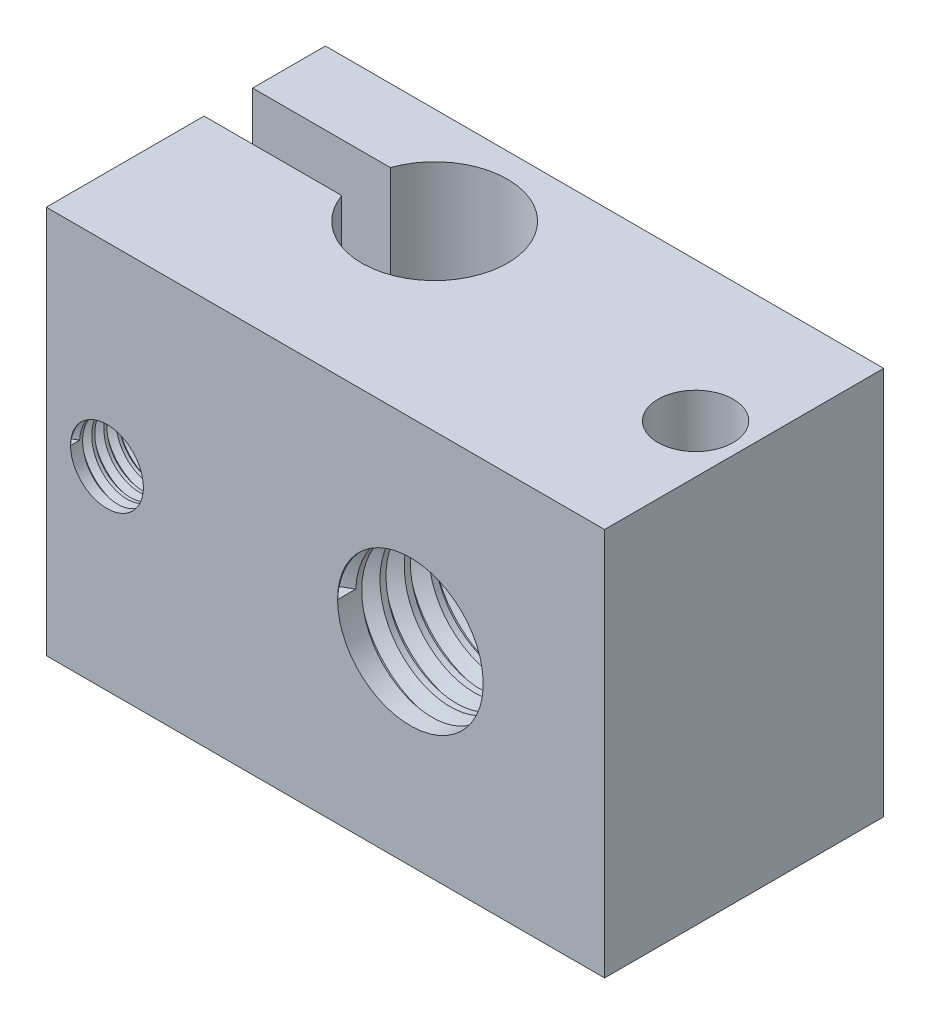
from build123d import *
from build123d.topology import SkipClean

# Parameters (mm, degrees)
SKETCH1_W           = 23
SKETCH1_H           = 16
SKETCH1_R           = 3
SKETCH1_R_2         = 1.5
BOSS_EXTRUDE1_DEPTH = 11.5
SKETCH10_R          = 1.55
CUT_EXTRUDE1_DEPTH  = 26.382080293
SKETCH11_R          = 1.5
CUT_EXTRUDE2_DEPTH  = 6.025
THREAD1_PITCH       = 0.5
THREAD2_PITCH       = 1
THREAD3_PITCH       = 0.5


with BuildPart() as part:
    # Sketch1 → Boss-Extrude1 (new body)
    with BuildSketch(Plane.XY):
        with Locations((4.5, -0.903225806)):
            Rectangle(SKETCH1_W, SKETCH1_H)
        with Locations((8, -0.903225806)):
            Circle(SKETCH1_R, mode=Mode.SUBTRACT)
        with Locations((-4.5, -0.903225806)):
            Circle(SKETCH1_R_2, mode=Mode.SUBTRACT)
    extrude(amount=BOSS_EXTRUDE1_DEPTH)

    # Sketch10 → Cut-Extrude1 (cut, through all)
    with BuildSketch(Plane.XZ.offset(8.903225806)):
        with Locations(Location((14, 5.75, 0), (0, 0, 270))):
            Circle(SKETCH10_R)
        with BuildLine():
            Line((-1.328427125, 5), (-7, 5))
            Line((-7, 5), (-7, 3))
            Line((-7, 3), (-1.328427125, 3))
            ThreePointArc((-1.328427125, 3), (4.5, 4), (-1.328427125, 5))
        make_face()
    extrude(amount=-CUT_EXTRUDE1_DEPTH, mode=Mode.SUBTRACT)

    # Sketch11 → Cut-Extrude2 (cut)
    with BuildSketch(Plane(origin=(0, 0, 0), x_dir=(-1, 0, 0), z_dir=(0, 0, -1))):
        with Locations((-14, -0.903225806)):
            Circle(SKETCH11_R)
    extrude(amount=-CUT_EXTRUDE2_DEPTH, mode=Mode.SUBTRACT)

    # Thread1: arcs per turn and ends read off the stored shape
    # Thread1: the profile of Thread Profile1 profile screwed along a right-hand helix through 23 turns, 6 arcs to a turn; built about Z, then put on its axis
    thread1_z = Axis((0, 0, 0), (0, 0, 1))
    thread1_corners = [(1.4997, 0, -0.000173205), (1.770632938, 0, 0.156249999), (1.770632938, 0, 0.218749999), (1.4997, 0, 0.375173204)]
    with BuildLine(mode=Mode.PRIVATE) as thread1_profile:
        Line(thread1_corners[0], thread1_corners[1])
        Line(thread1_corners[1], thread1_corners[2])
        Line(thread1_corners[2], thread1_corners[3])
        Line(thread1_corners[3], thread1_corners[0])
    thread1_cap = Face(thread1_profile.wire())
    thread1_turn_angles = [0, 30, 60, 90, 120, 150, 180, 210, 240, 270, 300, 330, 360]
    thread1_turn_weights = [1, 0.8660254037844387, 1, 0.8660254037844387, 1, 0.8660254037844387, 1, 0.8660254037844387, 1, 0.8660254037844387, 1, 0.8660254037844387, 1]
    thread1_turn_rails = [Edge.make_bspline([Vector(p[0], p[1], 0).rotate(thread1_z, thread1_turn_angles[k]) / thread1_turn_weights[k] + Vector(0, 0, p[2] + THREAD1_PITCH * thread1_turn_angles[k] / 360) for k in range(13)], [0, 0, 0, 1, 1, 2, 2, 3, 3, 4, 4, 5, 5, 6, 6, 6], 2, thread1_turn_weights) for p in thread1_corners]
    thread1_turn_sides = [Face.make_surface_from_curves(thread1_turn_rails[p[0]], thread1_turn_rails[p[1]]) for p in [(0, 1), (1, 2), (2, 3), (3, 0)]]
    thread1 = Plane(origin=(-4.5, -0.903225806, 11.5), x_dir=(-1, 0, 0), z_dir=(0, 0, -1)) * Solid(Shell([*[p.moved(Location((0, 0, THREAD1_PITCH * i))) for i in range(23) for p in thread1_turn_sides], thread1_cap, thread1_cap.rotate(thread1_z, 8280).moved(Location((0, 0, THREAD1_PITCH * 8280 / 360)))]))
    add(thread1, mode=Mode.SUBTRACT)

    # Thread2: arcs per turn and ends read off the stored shape
    # Thread2: the profile of Thread Profile2 profile screwed along a right-hand helix through 11.5 turns, 8 arcs to a turn; built about Z, then put on its axis
    thread2_z = Axis((0, 0, 0), (0, 0, 1))
    thread2_corners = [(2.9997, 0, -0.000173205), (3.541265875, 0, 0.312499999), (3.541265875, 0, 0.437499999), (2.9997, 0, 0.750173202)]
    with BuildLine(mode=Mode.PRIVATE) as thread2_profile:
        Line(thread2_corners[0], thread2_corners[1])
        Line(thread2_corners[1], thread2_corners[2])
        Line(thread2_corners[2], thread2_corners[3])
        Line(thread2_corners[3], thread2_corners[0])
    thread2_cap = Face(thread2_profile.wire())
    thread2_turn_angles = [0, 22.5, 45, 67.5, 90, 112.5, 135, 157.5, 180, 202.5, 225, 247.5, 270, 292.5, 315, 337.5, 360]
    thread2_turn_weights = [1, 0.9238795325112867, 1, 0.9238795325112867, 1, 0.9238795325112867, 1, 0.9238795325112867, 1, 0.9238795325112867, 1, 0.9238795325112867, 1, 0.9238795325112867, 1, 0.9238795325112867, 1]
    thread2_turn_rails = [Edge.make_bspline([Vector(p[0], p[1], 0).rotate(thread2_z, thread2_turn_angles[k]) / thread2_turn_weights[k] + Vector(0, 0, p[2] + THREAD2_PITCH * thread2_turn_angles[k] / 360) for k in range(17)], [0, 0, 0, 1, 1, 2, 2, 3, 3, 4, 4, 5, 5, 6, 6, 7, 7, 8, 8, 8], 2, thread2_turn_weights) for p in thread2_corners]
    thread2_turn_sides = [Face.make_surface_from_curves(thread2_turn_rails[p[0]], thread2_turn_rails[p[1]]) for p in [(0, 1), (1, 2), (2, 3), (3, 0)]]
    thread2_last_angles = [3960, 3982.5, 4005, 4027.5, 4050, 4072.5, 4095, 4117.5, 4140]
    thread2_last_weights = [1, 0.9238795325112867, 1, 0.9238795325112867, 1, 0.9238795325112867, 1, 0.9238795325112867, 1]
    thread2_last_rails = [Edge.make_bspline([Vector(p[0], p[1], 0).rotate(thread2_z, thread2_last_angles[k]) / thread2_last_weights[k] + Vector(0, 0, p[2] + THREAD2_PITCH * thread2_last_angles[k] / 360) for k in range(9)], [0, 0, 0, 1, 1, 2, 2, 3, 3, 4, 4, 4], 2, thread2_last_weights) for p in thread2_corners]
    thread2_last_sides = [Face.make_surface_from_curves(thread2_last_rails[p[0]], thread2_last_rails[p[1]]) for p in [(0, 1), (1, 2), (2, 3), (3, 0)]]
    thread2 = Plane(origin=(8, -0.903225806, 11.5), x_dir=(-1, 0, 0), z_dir=(0, 0, -1)) * Solid(Shell([*[p.moved(Location((0, 0, THREAD2_PITCH * i))) for i in range(11) for p in thread2_turn_sides], *thread2_last_sides, thread2_cap, thread2_cap.rotate(thread2_z, 4140).moved(Location((0, 0, THREAD2_PITCH * 4140 / 360)))]))
    add(thread2, mode=Mode.SUBTRACT)

    # Thread3: arcs per turn and ends read off the stored shape
    # Thread3: the profile of Thread Profile3 profile screwed along a right-hand helix through 10.718 turns, 6 arcs to a turn; built about Z, then put on its axis
    with SkipClean():  # the faces are left unmerged after this step: merging them gives an invalid solid
        thread3_z = Axis((0, 0, 0), (0, 0, 1))
        thread3_corners = [(1.4997, 0, -0.000173205), (1.770632937, 0, 0.156249999), (1.770632937, 0, 0.218749999), (1.4997, 0, 0.375173204)]
        with BuildLine(mode=Mode.PRIVATE) as thread3_profile:
            Line(thread3_corners[0], thread3_corners[1])
            Line(thread3_corners[1], thread3_corners[2])
            Line(thread3_corners[2], thread3_corners[3])
            Line(thread3_corners[3], thread3_corners[0])
        thread3_cap = Face(thread3_profile.wire())
        thread3_turn_angles = [0, 30, 60, 90, 120, 150, 180, 210, 240, 270, 300, 330, 360]
        thread3_turn_weights = [1, 0.8660254037844387, 1, 0.8660254037844387, 1, 0.8660254037844387, 1, 0.8660254037844387, 1, 0.8660254037844387, 1, 0.8660254037844387, 1]
        thread3_turn_rails = [Edge.make_bspline([Vector(p[0], p[1], 0).rotate(thread3_z, thread3_turn_angles[k]) / thread3_turn_weights[k] + Vector(0, 0, p[2] + THREAD3_PITCH * thread3_turn_angles[k] / 360) for k in range(13)], [0, 0, 0, 1, 1, 2, 2, 3, 3, 4, 4, 5, 5, 6, 6, 6], 2, thread3_turn_weights) for p in thread3_corners]
        thread3_turn_sides = [Face.make_surface_from_curves(thread3_turn_rails[p[0]], thread3_turn_rails[p[1]]) for p in [(0, 1), (1, 2), (2, 3), (3, 0)]]
        thread3_last_angles = [3600, 3630, 3660, 3690, 3720, 3750, 3780, 3810, 3840, 3849.24, 3858.48]
        thread3_last_weights = [1, 0.8660254037844387, 1, 0.8660254037844387, 1, 0.8660254037844387, 1, 0.8660254037844387, 1, 0.987024406397454, 1]
        thread3_last_rails = [Edge.make_bspline([Vector(p[0], p[1], 0).rotate(thread3_z, thread3_last_angles[k]) / thread3_last_weights[k] + Vector(0, 0, p[2] + THREAD3_PITCH * thread3_last_angles[k] / 360) for k in range(11)], [0, 0, 0, 1, 1, 2, 2, 3, 3, 4, 4, 5, 5, 5], 2, thread3_last_weights) for p in thread3_corners]
        thread3_last_sides = [Face.make_surface_from_curves(thread3_last_rails[p[0]], thread3_last_rails[p[1]]) for p in [(0, 1), (1, 2), (2, 3), (3, 0)]]
        thread3 = Plane(origin=(14, -0.903225806, 0), x_dir=(1, 0, 0), z_dir=(0, 0, 1)) * Solid(Shell([*[p.moved(Location((0, 0, THREAD3_PITCH * i))) for i in range(10) for p in thread3_turn_sides], *thread3_last_sides, thread3_cap, thread3_cap.rotate(thread3_z, 3858.48).moved(Location((0, 0, THREAD3_PITCH * 3858.48 / 360)))]))
        add(thread3, mode=Mode.SUBTRACT)


solid = part.part
